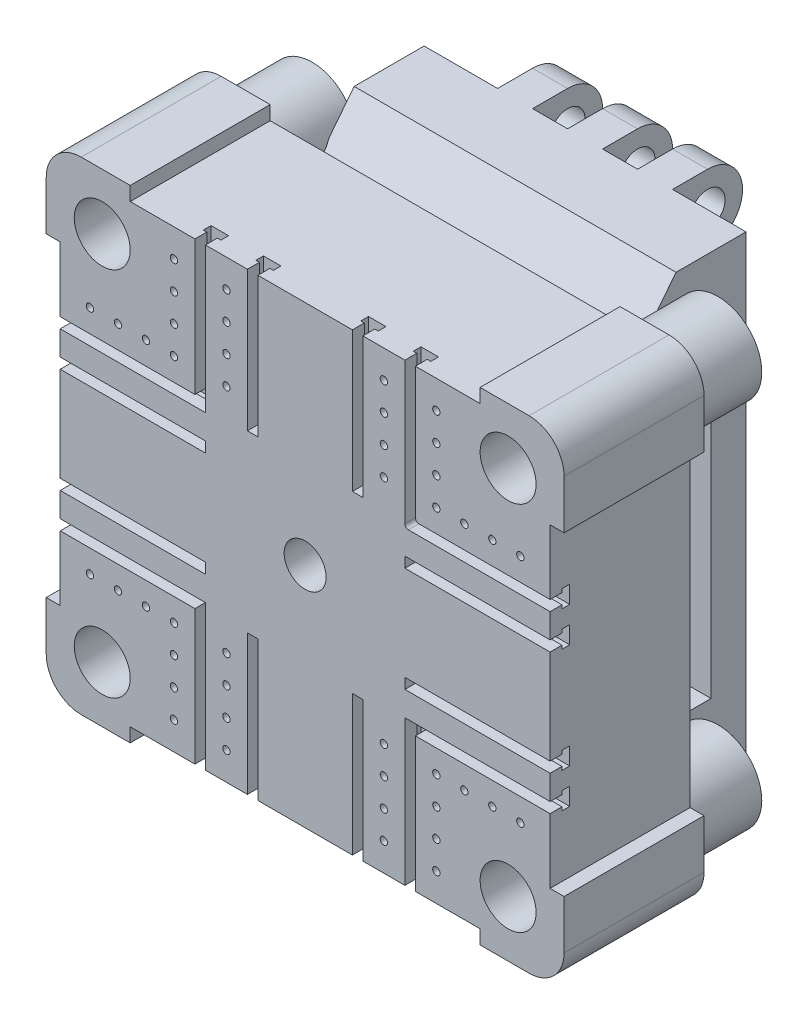
from build123d import *

# Parameters (mm, degrees)
SKETCH1_W                        = 1400
SKETCH1_H                        = 1300
BOSS_EXTRUDE1_DEPTH              = 400
SKETCH2_R                        = 80
BOSS_EXTRUDE2_DEPTH              = 4000
BOSS_EXTRUDE3_DEPTH              = 400
FILLET1_R                        = 100
FILLET1_OF_MIRROR1_R             = 100
MIRROR2_DEPTH                    = 400
SKETCH5_R                        = 60
CUT_EXTRUDE1_DEPTH               = 492
CUT_EXTRUDE2_DEPTH               = 400
MIRROR4_COPY_1_DEPTH             = 400
CUT_EXTRUDE3_REACH               = 4682.78
FILLET3_R                        = 10
CUT_EXTRUDE4_DEPTH               = 415
CUT_EXTRUDE5_DEPTH               = 415
CIRPATTERN1_COUNT                = 2
CIRPATTERN1_COPY_1_DEPTH         = 415
M24X3_0_TAPPED_HOLE1_AT_2_COUNT  = 2
M24X3_0_TAPPED_HOLE1_AT_2_PITCH  = 80
M24X3_0_TAPPED_HOLE1_AT_3_COUNT  = 2
M24X3_0_TAPPED_HOLE1_AT_3_PITCH  = 160
M24X3_0_TAPPED_HOLE1_AT_4_COUNT  = 2
M24X3_0_TAPPED_HOLE1_AT_4_PITCH  = 240
M24X3_0_TAPPED_HOLE1_AT_5_COUNT  = 2
M24X3_0_TAPPED_HOLE1_AT_5_PITCH  = 283.019433962
M24X3_0_TAPPED_HOLE1_AT_6_COUNT  = 2
M24X3_0_TAPPED_HOLE1_AT_6_PITCH  = 219.317121995
M24X3_0_TAPPED_HOLE1_AT_7_COUNT  = 2
M24X3_0_TAPPED_HOLE1_AT_7_PITCH  = 170
M24X3_0_TAPPED_HOLE1_AT_8_COUNT  = 2
M24X3_0_TAPPED_HOLE1_AT_8_PITCH  = 150
M24X3_0_TAPPED_HOLE1_AT_9_COUNT  = 2
M24X3_0_TAPPED_HOLE1_AT_9_PITCH  = 230
M24X3_0_TAPPED_HOLE1_AT_10_COUNT = 2
M24X3_0_TAPPED_HOLE1_AT_10_PITCH = 310
M24X3_0_TAPPED_HOLE1_AT_11_COUNT = 2
M24X3_0_TAPPED_HOLE1_AT_11_PITCH = 390
SKETCH15_R                       = 80
CUT_EXTRUDE6_DEPTH               = 5025
SKETCH16_R                       = 80
BOSS_EXTRUDE4_DEPTH              = 4000
CUT_EXTRUDE7_START               = -5500
SKETCH18_R                       = 80
CUT_EXTRUDE7_DEPTH               = 5500
BOSS_EXTRUDE5_START              = -600
SKETCH19_R                       = 125
SKETCH19_R_2                     = 80
BOSS_EXTRUDE5_DEPTH              = 600
BOSS_EXTRUDE6_DEPTH              = 460
BOSS_EXTRUDE6_DEPTH_BACK         = 460
SKETCH22_W                       = 300
SKETCH22_H                       = 900
CUT_EXTRUDE8_DEPTH               = 920
BOSS_EXTRUDE7_DEPTH              = 920
SKETCH26_W                       = 288.26551034
SKETCH26_H                       = 229.456304203
CUT_EXTRUDE12_DEPTH              = 100
CUT_EXTRUDE13_START              = -100
CUT_EXTRUDE13_DEPTH              = 470
SKETCH28_R                       = 50
CUT_EXTRUDE14_DEPTH              = 637
MIRROR27_COPY_1_SKETCH_W         = 288.26551034
MIRROR27_COPY_1_SKETCH_H         = 229.456304203
MIRROR27_COPY_1_DEPTH            = 100
MIRROR27_START                   = -100
MIRROR27_COPY_2_DEPTH            = 470


# Read off the part's stored shape, not the designer's step: Mirror2
with BuildPart() as part:
    # Sketch1 → Boss-Extrude1 (new body)
    with BuildSketch(Plane.XY):
        Rectangle(SKETCH1_W, SKETCH1_H)
    extrude(amount=BOSS_EXTRUDE1_DEPTH)

    # Sketch2 → Boss-Extrude2 (add)
    with BuildSketch(Plane.XY.offset(400)):
        with Locations(Location((-550, 450, 0), (0, 0, 180))):
            Circle(SKETCH2_R)
        with Locations(Location((550, 450, 0), (0, 0, 180))):
            Circle(SKETCH2_R)
        with Locations(Location((550, -450, 0), (0, 0, 180))):
            Circle(SKETCH2_R)
        with Locations(Location((-550, -450, 0), (0, 0, 180))):
            Circle(SKETCH2_R)
    extrude(amount=BOSS_EXTRUDE2_DEPTH)

    # Sketch3 → Boss-Extrude3 (add)
    with BuildSketch(Plane(origin=(0, 0, 0), x_dir=(-1, 0, 0), z_dir=(0, 0, -1))):
        Polygon((-700, 650), (-500, 650), (-500, 690), (-740, 690), (-740, 450), (-700, 450), align=None)
    boss_extrude3 = extrude(amount=-BOSS_EXTRUDE3_DEPTH)

    # Fillet1
    fillet1_edges = [part.edges().sort_by_distance(p)[0] for p in [
        (740, 690, 200),
    ]]
    fillet(fillet1_edges, radius=FILLET1_R)

    # Mirror1: Boss-Extrude3 across plane
    add(boss_extrude3.mirror(Plane(origin=(0, 0, 0), x_dir=(0, 0, 1), z_dir=(1, 0, 0))))

    # Fillet1 of Mirror1
    fillet1_of_mirror1_edges = [part.edges().sort_by_distance(p)[0] for p in [
        (-740, 690, 200),
    ]]
    fillet(fillet1_of_mirror1_edges, radius=FILLET1_OF_MIRROR1_R)

    # Mirror2 outline → Mirror2 (add)
    with BuildSketch(Plane.XY):
        with BuildLine():
            Line((-500, -690), (-500, -650))
            Line((-500, -650), (-700, -650))
            Line((-700, -650), (-700, -450))
            Line((-700, -450), (-740, -450))
            Line((-740, -450), (-740, -590))
            ThreePointArc((-740, -590), (-710.710678119, -660.710678119), (-640, -690))
            Line((-640, -690), (-500, -690))
        make_face()
        with BuildLine():
            Line((740, -590), (740, -450))
            Line((740, -450), (700, -450))
            Line((700, -450), (700, -650))
            Line((700, -650), (500, -650))
            Line((500, -650), (500, -690))
            Line((500, -690), (640, -690))
            ThreePointArc((640, -690), (710.710678119, -660.710678119), (740, -590))
        make_face()
    extrude(amount=MIRROR2_DEPTH)

    # Sketch5 → Cut-Extrude1 (cut)
    with BuildSketch(Plane.XY.offset(400)):
        Circle(SKETCH5_R)
    extrude(amount=-CUT_EXTRUDE1_DEPTH, mode=Mode.SUBTRACT)

    # Sketch7 → Cut-Extrude2 (cut)
    with BuildSketch(Plane.XZ.offset(650)):
        Polygon((275, 344), (325, 344), (325, 366), (315, 366), (315, 400), (285, 400), (285, 366), (275, 366), align=None)
        Polygon((125, 344), (175, 344), (175, 366), (165, 366), (165, 400), (135, 400), (135, 366), (125, 366), align=None)
    cut_extrude2 = extrude(amount=-CUT_EXTRUDE2_DEPTH, mode=Mode.SUBTRACT)

    # Mirror3: Cut-Extrude2 across plane
    add(cut_extrude2.mirror(Plane(origin=(0, 0, 0), x_dir=(0, 0, 1), z_dir=(1, 0, 0))), mode=Mode.SUBTRACT)

    # Mirror4: Cut-Extrude2 across plane
    add(cut_extrude2.mirror(Plane.ZX), mode=Mode.SUBTRACT)

    # Mirror4 copy 1 sketch → Mirror4 copy 1 (cut)
    with BuildSketch(Plane(origin=(0, 650, 0), x_dir=(-1, 0, 0), z_dir=(0, 1, 0))):
        Polygon((275, 344), (325, 344), (325, 366), (315, 366), (315, 400), (285, 400), (285, 366), (275, 366), align=None)
        Polygon((125, 344), (175, 344), (175, 366), (165, 366), (165, 400), (135, 400), (135, 366), (125, 366), align=None)
    extrude(amount=-MIRROR4_COPY_1_DEPTH, mode=Mode.SUBTRACT)

    # Cut-Extrude3: up to this face of the body (flat: up to its plane)
    cut_extrude3_end = Plane(part.part.faces().sort_by_distance((285, 450, 383))[0])
    # Sketch8 → Cut-Extrude3 (cut, up to the picked face)
    with BuildSketch(Plane(origin=(700, 0, 0), x_dir=(0, 0, -1), z_dir=(1, 0, 0)), mode=Mode.PRIVATE) as cut_extrude3_sk1:
        Polygon((-344, 275), (-344, 225), (-366, 225), (-366, 235), (-400, 235), (-400, 265), (-366, 265), (-366, 275), align=None)
    cut_extrude3_tool1 = split(extrude(cut_extrude3_sk1.sketch, amount=-CUT_EXTRUDE3_REACH, mode=Mode.PRIVATE), bisect_by=cut_extrude3_end, keep=Keep.BOTH, mode=Mode.PRIVATE)
    cut_extrude3 = cut_extrude3_tool1.solids().sort_by(Axis((700, 250, 368.471698), (-1, 0, 0)))[0]
    add(cut_extrude3, mode=Mode.SUBTRACT)

    # Fillet3
    fillet3_edges = [part.edges().sort_by_distance(p)[0] for p in [
        (315, 265, 383),
        (285, 235, 383),
    ]]
    fillet(fillet3_edges, radius=FILLET3_R)

    # Mirror5: Cut-Extrude3 across plane
    add(cut_extrude3.mirror(Plane.ZX), mode=Mode.SUBTRACT)

    # Sketch9 → Cut-Extrude4 (cut)
    with BuildSketch(Plane.ZY.offset(700)):
        Polygon((400, 265), (366, 265), (366, 275), (344, 275), (344, 225), (366, 225), (366, 235), (400, 235), align=None)
    cut_extrude4 = extrude(amount=-CUT_EXTRUDE4_DEPTH, mode=Mode.SUBTRACT)

    # Mirror12: Cut-Extrude4 across plane
    add(cut_extrude4.mirror(Plane.ZX), mode=Mode.SUBTRACT)

    # Sketch10 → Cut-Extrude5 (cut)
    with BuildSketch(Plane(origin=(700, 0, 0), x_dir=(0, 0, -1), z_dir=(1, 0, 0))):
        Polygon((-344, 175), (-344, 125), (-366, 125), (-366, 135), (-400, 135), (-400, 165), (-366, 165), (-366, 175), align=None)
    cut_extrude5 = extrude(amount=-CUT_EXTRUDE5_DEPTH, mode=Mode.SUBTRACT)

    # Mirror13: Cut-Extrude5 across plane
    add(cut_extrude5.mirror(Plane.ZX), mode=Mode.SUBTRACT)

    # CirPattern1: Cut-Extrude5 ×2 about axis
    cirpattern1_axis = Axis((0, 0, 0), (0, 0, 1))
    for i in range(1, CIRPATTERN1_COUNT):
        add(cut_extrude5.rotate(cirpattern1_axis, i * 360 / CIRPATTERN1_COUNT), mode=Mode.SUBTRACT)

    # CirPattern1 copy 1 sketch → CirPattern1 copy 1 (cut)
    with BuildSketch(Plane(origin=(-700, 0, 0), x_dir=(0, 0, -1), z_dir=(-1, 0, 0))):
        Polygon((-344, -175), (-344, -125), (-366, -125), (-366, -135), (-400, -135), (-400, -165), (-366, -165), (-366, -175), align=None)
    extrude(amount=-CIRPATTERN1_COPY_1_DEPTH, mode=Mode.SUBTRACT)

    # Sketch14 → M24x3.0 Tapped Hole1 (revolve, cut)
    with BuildSketch(Plane(origin=(225, -330, 400), x_dir=(0, -1, 0), z_dir=(1, 0, 0))):
        Polygon((0, 0), (0, 66.3090365), (10.5, 60), (10.5, 0), align=None)
    m24x3_0_tapped_hole1 = revolve(axis=Axis((225, -330, 406.35), (0, 0, -1)), mode=Mode.SUBTRACT)

    # M24x3.0 Tapped Hole1 at 2: M24x3.0 Tapped Hole1 ×2
    with Locations(*[(0, -i * M24X3_0_TAPPED_HOLE1_AT_2_PITCH, 0) for i in range(1, M24X3_0_TAPPED_HOLE1_AT_2_COUNT)]):
        add(m24x3_0_tapped_hole1, mode=Mode.SUBTRACT)

    # M24x3.0 Tapped Hole1 at 3: M24x3.0 Tapped Hole1 ×2
    with Locations(*[(0, -i * M24X3_0_TAPPED_HOLE1_AT_3_PITCH, 0) for i in range(1, M24X3_0_TAPPED_HOLE1_AT_3_COUNT)]):
        add(m24x3_0_tapped_hole1, mode=Mode.SUBTRACT)

    # M24x3.0 Tapped Hole1 at 4: M24x3.0 Tapped Hole1 ×2
    with Locations(*[(0, -i * M24X3_0_TAPPED_HOLE1_AT_4_PITCH, 0) for i in range(1, M24X3_0_TAPPED_HOLE1_AT_4_COUNT)]):
        add(m24x3_0_tapped_hole1, mode=Mode.SUBTRACT)

    # M24x3.0 Tapped Hole1 at 5: M24x3.0 Tapped Hole1 ×2
    with Locations(*[Vector(0.5299989400031799, -0.8479983040050881, 0) * (i * M24X3_0_TAPPED_HOLE1_AT_5_PITCH) for i in range(1, M24X3_0_TAPPED_HOLE1_AT_5_COUNT)]):
        add(m24x3_0_tapped_hole1, mode=Mode.SUBTRACT)

    # M24x3.0 Tapped Hole1 at 6: M24x3.0 Tapped Hole1 ×2
    with Locations(*[Vector(0.6839411288813297, -0.7295372041400852, 0) * (i * M24X3_0_TAPPED_HOLE1_AT_6_PITCH) for i in range(1, M24X3_0_TAPPED_HOLE1_AT_6_COUNT)]):
        add(m24x3_0_tapped_hole1, mode=Mode.SUBTRACT)

    # M24x3.0 Tapped Hole1 at 7: M24x3.0 Tapped Hole1 ×2
    with Locations(*[Vector(0.8823529411764706, -0.47058823529411786, 0) * (i * M24X3_0_TAPPED_HOLE1_AT_7_PITCH) for i in range(1, M24X3_0_TAPPED_HOLE1_AT_7_COUNT)]):
        add(m24x3_0_tapped_hole1, mode=Mode.SUBTRACT)

    # M24x3.0 Tapped Hole1 at 8: M24x3.0 Tapped Hole1 ×2
    with Locations(*[(i * M24X3_0_TAPPED_HOLE1_AT_8_PITCH, 0, 0) for i in range(1, M24X3_0_TAPPED_HOLE1_AT_8_COUNT)]):
        add(m24x3_0_tapped_hole1, mode=Mode.SUBTRACT)

    # M24x3.0 Tapped Hole1 at 9: M24x3.0 Tapped Hole1 ×2
    with Locations(*[(i * M24X3_0_TAPPED_HOLE1_AT_9_PITCH, 0, 0) for i in range(1, M24X3_0_TAPPED_HOLE1_AT_9_COUNT)]):
        add(m24x3_0_tapped_hole1, mode=Mode.SUBTRACT)

    # M24x3.0 Tapped Hole1 at 10: M24x3.0 Tapped Hole1 ×2
    with Locations(*[(i * M24X3_0_TAPPED_HOLE1_AT_10_PITCH, 0, 0) for i in range(1, M24X3_0_TAPPED_HOLE1_AT_10_COUNT)]):
        add(m24x3_0_tapped_hole1, mode=Mode.SUBTRACT)

    # M24x3.0 Tapped Hole1 at 11: M24x3.0 Tapped Hole1 ×2
    with Locations(*[(i * M24X3_0_TAPPED_HOLE1_AT_11_PITCH, 0, 0) for i in range(1, M24X3_0_TAPPED_HOLE1_AT_11_COUNT)]):
        add(m24x3_0_tapped_hole1, mode=Mode.SUBTRACT)

    # Mirror22: M24x3.0 Tapped Hole1 across plane
    add(m24x3_0_tapped_hole1.mirror(Plane.ZX), mode=Mode.SUBTRACT)

    # Mirror22 copy 1 sketch → Mirror22 copy 1 (revolve, cut)
    with BuildSketch(Plane(origin=(225, 410, 400), x_dir=(0, 1, 0), z_dir=(1, 0, 0))):
        Polygon((0, 0), (0, -66.3090365), (10.5, -60), (10.5, 0), align=None)
    revolve(axis=Axis((225, 410, 406.35), (0, 0, 1)), mode=Mode.SUBTRACT)

    # Mirror22 copy 2 sketch → Mirror22 copy 2 (revolve, cut)
    with BuildSketch(Plane(origin=(225, 490, 400), x_dir=(0, 1, 0), z_dir=(1, 0, 0))):
        Polygon((0, 0), (0, -66.3090365), (10.5, -60), (10.5, 0), align=None)
    revolve(axis=Axis((225, 490, 406.35), (0, 0, 1)), mode=Mode.SUBTRACT)

    # Mirror22 copy 3 sketch → Mirror22 copy 3 (revolve, cut)
    with BuildSketch(Plane(origin=(225, 570, 400), x_dir=(0, 1, 0), z_dir=(1, 0, 0))):
        Polygon((0, 0), (0, -66.3090365), (10.5, -60), (10.5, 0), align=None)
    revolve(axis=Axis((225, 570, 406.35), (0, 0, 1)), mode=Mode.SUBTRACT)

    # Mirror22 copy 4 sketch → Mirror22 copy 4 (revolve, cut)
    with BuildSketch(Plane(origin=(375, 570, 400), x_dir=(0, 1, 0), z_dir=(1, 0, 0))):
        Polygon((0, 0), (0, -66.3090365), (10.5, -60), (10.5, 0), align=None)
    revolve(axis=Axis((375, 570, 406.35), (0, 0, 1)), mode=Mode.SUBTRACT)

    # Mirror22 copy 5 sketch → Mirror22 copy 5 (revolve, cut)
    with BuildSketch(Plane(origin=(375, 490, 400), x_dir=(0, 1, 0), z_dir=(1, 0, 0))):
        Polygon((0, 0), (0, -66.3090365), (10.5, -60), (10.5, 0), align=None)
    revolve(axis=Axis((375, 490, 406.35), (0, 0, 1)), mode=Mode.SUBTRACT)

    # Mirror22 copy 6 sketch → Mirror22 copy 6 (revolve, cut)
    with BuildSketch(Plane(origin=(375, 410, 400), x_dir=(0, 1, 0), z_dir=(1, 0, 0))):
        Polygon((0, 0), (0, -66.3090365), (10.5, -60), (10.5, 0), align=None)
    revolve(axis=Axis((375, 410, 406.35), (0, 0, 1)), mode=Mode.SUBTRACT)

    # Mirror22 copy 7 sketch → Mirror22 copy 7 (revolve, cut)
    with BuildSketch(Plane(origin=(375, 330, 400), x_dir=(0, 1, 0), z_dir=(1, 0, 0))):
        Polygon((0, 0), (0, -66.3090365), (10.5, -60), (10.5, 0), align=None)
    revolve(axis=Axis((375, 330, 406.35), (0, 0, 1)), mode=Mode.SUBTRACT)

    # Mirror22 copy 8 sketch → Mirror22 copy 8 (revolve, cut)
    with BuildSketch(Plane(origin=(455, 330, 400), x_dir=(0, 1, 0), z_dir=(1, 0, 0))):
        Polygon((0, 0), (0, -66.3090365), (10.5, -60), (10.5, 0), align=None)
    revolve(axis=Axis((455, 330, 406.35), (0, 0, 1)), mode=Mode.SUBTRACT)

    # Mirror22 copy 9 sketch → Mirror22 copy 9 (revolve, cut)
    with BuildSketch(Plane(origin=(535, 330, 400), x_dir=(0, 1, 0), z_dir=(1, 0, 0))):
        Polygon((0, 0), (0, -66.3090365), (10.5, -60), (10.5, 0), align=None)
    revolve(axis=Axis((535, 330, 406.35), (0, 0, 1)), mode=Mode.SUBTRACT)

    # Mirror22 copy 10 sketch → Mirror22 copy 10 (revolve, cut)
    with BuildSketch(Plane(origin=(615, 330, 400), x_dir=(0, 1, 0), z_dir=(1, 0, 0))):
        Polygon((0, 0), (0, -66.3090365), (10.5, -60), (10.5, 0), align=None)
    revolve(axis=Axis((615, 330, 406.35), (0, 0, 1)), mode=Mode.SUBTRACT)

    # Mirror23: M24x3.0 Tapped Hole1 across plane
    add(m24x3_0_tapped_hole1.mirror(Plane(origin=(0, 0, 0), x_dir=(0, 0, 1), z_dir=(1, 0, 0))), mode=Mode.SUBTRACT)

    # Mirror23 copy 1 sketch → Mirror23 copy 1 (revolve, cut)
    with BuildSketch(Plane(origin=(-225, -410, 400), x_dir=(0, -1, 0), z_dir=(-1, 0, 0))):
        Polygon((0, 0), (0, -66.3090365), (10.5, -60), (10.5, 0), align=None)
    revolve(axis=Axis((-225, -410, 406.35), (0, 0, 1)), mode=Mode.SUBTRACT)

    # Mirror23 copy 2 sketch → Mirror23 copy 2 (revolve, cut)
    with BuildSketch(Plane(origin=(-225, -490, 400), x_dir=(0, -1, 0), z_dir=(-1, 0, 0))):
        Polygon((0, 0), (0, -66.3090365), (10.5, -60), (10.5, 0), align=None)
    revolve(axis=Axis((-225, -490, 406.35), (0, 0, 1)), mode=Mode.SUBTRACT)

    # Mirror23 copy 3 sketch → Mirror23 copy 3 (revolve, cut)
    with BuildSketch(Plane(origin=(-225, -570, 400), x_dir=(0, -1, 0), z_dir=(-1, 0, 0))):
        Polygon((0, 0), (0, -66.3090365), (10.5, -60), (10.5, 0), align=None)
    revolve(axis=Axis((-225, -570, 406.35), (0, 0, 1)), mode=Mode.SUBTRACT)

    # Mirror23 copy 4 sketch → Mirror23 copy 4 (revolve, cut)
    with BuildSketch(Plane(origin=(-375, -570, 400), x_dir=(0, -1, 0), z_dir=(-1, 0, 0))):
        Polygon((0, 0), (0, -66.3090365), (10.5, -60), (10.5, 0), align=None)
    revolve(axis=Axis((-375, -570, 406.35), (0, 0, 1)), mode=Mode.SUBTRACT)

    # Mirror23 copy 5 sketch → Mirror23 copy 5 (revolve, cut)
    with BuildSketch(Plane(origin=(-375, -490, 400), x_dir=(0, -1, 0), z_dir=(-1, 0, 0))):
        Polygon((0, 0), (0, -66.3090365), (10.5, -60), (10.5, 0), align=None)
    revolve(axis=Axis((-375, -490, 406.35), (0, 0, 1)), mode=Mode.SUBTRACT)

    # Mirror23 copy 6 sketch → Mirror23 copy 6 (revolve, cut)
    with BuildSketch(Plane(origin=(-375, -410, 400), x_dir=(0, -1, 0), z_dir=(-1, 0, 0))):
        Polygon((0, 0), (0, -66.3090365), (10.5, -60), (10.5, 0), align=None)
    revolve(axis=Axis((-375, -410, 406.35), (0, 0, 1)), mode=Mode.SUBTRACT)

    # Mirror23 copy 7 sketch → Mirror23 copy 7 (revolve, cut)
    with BuildSketch(Plane(origin=(-375, -330, 400), x_dir=(0, -1, 0), z_dir=(-1, 0, 0))):
        Polygon((0, 0), (0, -66.3090365), (10.5, -60), (10.5, 0), align=None)
    revolve(axis=Axis((-375, -330, 406.35), (0, 0, 1)), mode=Mode.SUBTRACT)

    # Mirror23 copy 8 sketch → Mirror23 copy 8 (revolve, cut)
    with BuildSketch(Plane(origin=(-455, -330, 400), x_dir=(0, -1, 0), z_dir=(-1, 0, 0))):
        Polygon((0, 0), (0, -66.3090365), (10.5, -60), (10.5, 0), align=None)
    revolve(axis=Axis((-455, -330, 406.35), (0, 0, 1)), mode=Mode.SUBTRACT)

    # Mirror23 copy 9 sketch → Mirror23 copy 9 (revolve, cut)
    with BuildSketch(Plane(origin=(-535, -330, 400), x_dir=(0, -1, 0), z_dir=(-1, 0, 0))):
        Polygon((0, 0), (0, -66.3090365), (10.5, -60), (10.5, 0), align=None)
    revolve(axis=Axis((-535, -330, 406.35), (0, 0, 1)), mode=Mode.SUBTRACT)

    # Mirror23 copy 10 sketch → Mirror23 copy 10 (revolve, cut)
    with BuildSketch(Plane(origin=(-615, -330, 400), x_dir=(0, -1, 0), z_dir=(-1, 0, 0))):
        Polygon((0, 0), (0, -66.3090365), (10.5, -60), (10.5, 0), align=None)
    revolve(axis=Axis((-615, -330, 406.35), (0, 0, 1)), mode=Mode.SUBTRACT)

    # Mirror23 copy 11 sketch → Mirror23 copy 11 (revolve, cut)
    with BuildSketch(Plane(origin=(-225, 330, 400), x_dir=(0, 1, 0), z_dir=(-1, 0, 0))):
        Polygon((0, 0), (0, 66.3090365), (10.5, 60), (10.5, 0), align=None)
    revolve(axis=Axis((-225, 330, 406.35), (0, 0, -1)), mode=Mode.SUBTRACT)

    # Mirror23 copy 12 sketch → Mirror23 copy 12 (revolve, cut)
    with BuildSketch(Plane(origin=(-225, 410, 400), x_dir=(0, 1, 0), z_dir=(-1, 0, 0))):
        Polygon((0, 0), (0, 66.3090365), (10.5, 60), (10.5, 0), align=None)
    revolve(axis=Axis((-225, 410, 406.35), (0, 0, -1)), mode=Mode.SUBTRACT)

    # Mirror23 copy 13 sketch → Mirror23 copy 13 (revolve, cut)
    with BuildSketch(Plane(origin=(-225, 490, 400), x_dir=(0, 1, 0), z_dir=(-1, 0, 0))):
        Polygon((0, 0), (0, 66.3090365), (10.5, 60), (10.5, 0), align=None)
    revolve(axis=Axis((-225, 490, 406.35), (0, 0, -1)), mode=Mode.SUBTRACT)

    # Mirror23 copy 14 sketch → Mirror23 copy 14 (revolve, cut)
    with BuildSketch(Plane(origin=(-225, 570, 400), x_dir=(0, 1, 0), z_dir=(-1, 0, 0))):
        Polygon((0, 0), (0, 66.3090365), (10.5, 60), (10.5, 0), align=None)
    revolve(axis=Axis((-225, 570, 406.35), (0, 0, -1)), mode=Mode.SUBTRACT)

    # Mirror23 copy 15 sketch → Mirror23 copy 15 (revolve, cut)
    with BuildSketch(Plane(origin=(-375, 570, 400), x_dir=(0, 1, 0), z_dir=(-1, 0, 0))):
        Polygon((0, 0), (0, 66.3090365), (10.5, 60), (10.5, 0), align=None)
    revolve(axis=Axis((-375, 570, 406.35), (0, 0, -1)), mode=Mode.SUBTRACT)

    # Mirror23 copy 16 sketch → Mirror23 copy 16 (revolve, cut)
    with BuildSketch(Plane(origin=(-375, 490, 400), x_dir=(0, 1, 0), z_dir=(-1, 0, 0))):
        Polygon((0, 0), (0, 66.3090365), (10.5, 60), (10.5, 0), align=None)
    revolve(axis=Axis((-375, 490, 406.35), (0, 0, -1)), mode=Mode.SUBTRACT)

    # Mirror23 copy 17 sketch → Mirror23 copy 17 (revolve, cut)
    with BuildSketch(Plane(origin=(-375, 410, 400), x_dir=(0, 1, 0), z_dir=(-1, 0, 0))):
        Polygon((0, 0), (0, 66.3090365), (10.5, 60), (10.5, 0), align=None)
    revolve(axis=Axis((-375, 410, 406.35), (0, 0, -1)), mode=Mode.SUBTRACT)

    # Mirror23 copy 18 sketch → Mirror23 copy 18 (revolve, cut)
    with BuildSketch(Plane(origin=(-375, 330, 400), x_dir=(0, 1, 0), z_dir=(-1, 0, 0))):
        Polygon((0, 0), (0, 66.3090365), (10.5, 60), (10.5, 0), align=None)
    revolve(axis=Axis((-375, 330, 406.35), (0, 0, -1)), mode=Mode.SUBTRACT)

    # Mirror23 copy 19 sketch → Mirror23 copy 19 (revolve, cut)
    with BuildSketch(Plane(origin=(-455, 330, 400), x_dir=(0, 1, 0), z_dir=(-1, 0, 0))):
        Polygon((0, 0), (0, 66.3090365), (10.5, 60), (10.5, 0), align=None)
    revolve(axis=Axis((-455, 330, 406.35), (0, 0, -1)), mode=Mode.SUBTRACT)

    # Mirror23 copy 20 sketch → Mirror23 copy 20 (revolve, cut)
    with BuildSketch(Plane(origin=(-535, 330, 400), x_dir=(0, 1, 0), z_dir=(-1, 0, 0))):
        Polygon((0, 0), (0, 66.3090365), (10.5, 60), (10.5, 0), align=None)
    revolve(axis=Axis((-535, 330, 406.35), (0, 0, -1)), mode=Mode.SUBTRACT)

    # Mirror23 copy 21 sketch → Mirror23 copy 21 (revolve, cut)
    with BuildSketch(Plane(origin=(-615, 330, 400), x_dir=(0, 1, 0), z_dir=(-1, 0, 0))):
        Polygon((0, 0), (0, 66.3090365), (10.5, 60), (10.5, 0), align=None)
    revolve(axis=Axis((-615, 330, 406.35), (0, 0, -1)), mode=Mode.SUBTRACT)

    # Sketch15 → Cut-Extrude6 (cut)
    with BuildSketch(Plane.XY.offset(400)):
        with Locations((-550, 450)):
            Circle(SKETCH15_R)
        with Locations((550, 450)):
            Circle(SKETCH15_R)
        with Locations((550, -450)):
            Circle(SKETCH15_R)
        with Locations((-550, -450)):
            Circle(SKETCH15_R)
    extrude(amount=CUT_EXTRUDE6_DEPTH, mode=Mode.SUBTRACT)

    # Sketch16 → Boss-Extrude4 (add)
    with BuildSketch(Plane.XY.offset(400)):
        with Locations(Location((-580, 530, 0), (0, 0, 180))):
            Circle(SKETCH16_R)
        with Locations(Location((580, 530, 0), (0, 0, 180))):
            Circle(SKETCH16_R)
        with Locations(Location((580, -530, 0), (0, 0, 180))):
            Circle(SKETCH16_R)
        with Locations(Location((-580, -530, 0), (0, 0, 180))):
            Circle(SKETCH16_R)
    extrude(amount=BOSS_EXTRUDE4_DEPTH)

    # Sketch18 → Cut-Extrude7 (cut)
    with BuildSketch(Plane.XY.offset(4400).offset(CUT_EXTRUDE7_START)):
        with Locations(Location((580, 530, 0), (0, 0, 180))):
            Circle(SKETCH18_R)
        with Locations(Location((580, -530, 0), (0, 0, 180))):
            Circle(SKETCH18_R)
        with Locations(Location((-580, 530, 0), (0, 0, 180))):
            Circle(SKETCH18_R)
        with Locations(Location((-580, -530, 0), (0, 0, 180))):
            Circle(SKETCH18_R)
    extrude(amount=CUT_EXTRUDE7_DEPTH, mode=Mode.SUBTRACT)

    # Sketch19 → Boss-Extrude5 (add)
    # profile 1 of 4: a face of its own
    with BuildSketch(Plane.XY.offset(400).offset(BOSS_EXTRUDE5_START)):
        with Locations((-580, 530)):
            Circle(SKETCH19_R)
        with Locations((-580, 530)):
            Circle(SKETCH19_R_2, mode=Mode.SUBTRACT)
    # profile 2 of 4: a face of its own
    with BuildSketch(Plane.XY.offset(400).offset(BOSS_EXTRUDE5_START)):
        with Locations((580, 530)):
            Circle(SKETCH19_R)
        with Locations((580, 530)):
            Circle(SKETCH19_R_2, mode=Mode.SUBTRACT)
    # profile 3 of 4: a face of its own
    with BuildSketch(Plane.XY.offset(400).offset(BOSS_EXTRUDE5_START)):
        with Locations((580, -530)):
            Circle(SKETCH19_R)
        with Locations((580, -530)):
            Circle(SKETCH19_R_2, mode=Mode.SUBTRACT)
    # profile 4 of 4: a face of its own
    with BuildSketch(Plane.XY.offset(400).offset(BOSS_EXTRUDE5_START)):
        with Locations((-580, -530)):
            Circle(SKETCH19_R)
        with Locations((-580, -530)):
            Circle(SKETCH19_R_2, mode=Mode.SUBTRACT)
    extrude(amount=BOSS_EXTRUDE5_DEPTH)

    # Sketch21 → Boss-Extrude6 (add, two sides: drawn at the far end of the back side and taken through both)
    with BuildSketch(Plane(origin=(0, 0, 0), x_dir=(0, 0, -1), z_dir=(1, 0, 0)).offset(-BOSS_EXTRUDE6_DEPTH_BACK)):
        Polygon((0, -400), (0, 400), (200, 655), (400, 655), (400, -655), (200, -655), align=None)
    extrude(amount=BOSS_EXTRUDE6_DEPTH + BOSS_EXTRUDE6_DEPTH_BACK)

    # Sketch22 → Cut-Extrude8 (cut)
    with BuildSketch(Plane(origin=(460, 0, 0), x_dir=(0, 0, -1), z_dir=(1, 0, 0))):
        with Locations((150, 0)):
            Rectangle(SKETCH22_W, SKETCH22_H)
    extrude(amount=-CUT_EXTRUDE8_DEPTH, mode=Mode.SUBTRACT)

    # Sketch23 → Boss-Extrude7 (add)
    with BuildSketch(Plane.ZY.offset(460)):
        with BuildLine():
            Line((-400, 655), (-500, 655))
            ThreePointArc((-500, 655), (-600, 555), (-500, 455))
            Line((-500, 455), (-400, 455))
            Line((-400, 455), (-400, 655))
        make_face()
    boss_extrude7 = extrude(amount=-BOSS_EXTRUDE7_DEPTH)

    # Mirror24: Boss-Extrude7 across plane
    add(boss_extrude7.mirror(Plane.ZX))

    # Sketch26 → Cut-Extrude12 (cut)
    with BuildSketch(Plane(origin=(50, 0, 0), x_dir=(0, 0, -1), z_dir=(1, 0, 0))):
        with Locations((544.13275517, 569.728152101)):
            Rectangle(SKETCH26_W, SKETCH26_H)
    cut_extrude12 = extrude(amount=CUT_EXTRUDE12_DEPTH, mode=Mode.SUBTRACT)

    # Mirror25: Cut-Extrude12 across plane
    add(cut_extrude12.mirror(Plane(origin=(0, 0, 0), x_dir=(0, 0, 1), z_dir=(1, 0, 0))), mode=Mode.SUBTRACT)

    # Sketch27 → Cut-Extrude13 (cut)
    with BuildSketch(Plane.ZY.offset(-150).offset(CUT_EXTRUDE13_START)):
        with BuildLine():
            Line((-500, 455), (-400, 455))
            Line((-400, 455), (-400, 655))
            Line((-400, 655), (-500, 655))
            ThreePointArc((-500, 655), (-600, 555), (-500, 455))
        make_face()
    cut_extrude13 = extrude(amount=-CUT_EXTRUDE13_DEPTH, mode=Mode.SUBTRACT)

    # Mirror26: Cut-Extrude13 across plane
    add(cut_extrude13.mirror(Plane(origin=(0, 0, 0), x_dir=(0, 0, 1), z_dir=(1, 0, 0))), mode=Mode.SUBTRACT)

    # Sketch28 → Cut-Extrude14 (cut)
    with BuildSketch(Plane(origin=(250, 0, 0), x_dir=(0, 0, -1), z_dir=(1, 0, 0))):
        with Locations((500, 555)):
            Circle(SKETCH28_R)
    cut_extrude14 = extrude(amount=-CUT_EXTRUDE14_DEPTH, mode=Mode.SUBTRACT)

    # Mirror27: Cut-Extrude12, Cut-Extrude13, Cut-Extrude14 across plane
    add(cut_extrude12.mirror(Plane.ZX), mode=Mode.SUBTRACT)
    add(cut_extrude13.mirror(Plane.ZX), mode=Mode.SUBTRACT)
    add(cut_extrude14.mirror(Plane.ZX), mode=Mode.SUBTRACT)

    # Mirror27 copy 1 sketch → Mirror27 copy 1 (cut)
    with BuildSketch(Plane(origin=(-50, 0, 0), x_dir=(0, 0, -1), z_dir=(-1, 0, 0))):
        with Locations((544.13275517, 569.728152101)):
            Rectangle(MIRROR27_COPY_1_SKETCH_W, MIRROR27_COPY_1_SKETCH_H)
    extrude(amount=MIRROR27_COPY_1_DEPTH, mode=Mode.SUBTRACT)

    # Mirror27 copy 2 sketch → Mirror27 copy 2 (cut)
    with BuildSketch(Plane(origin=(-150, 0, 0), x_dir=(0, 0, 1), z_dir=(1, 0, 0)).offset(MIRROR27_START)):
        with BuildLine():
            Line((-500, 455), (-400, 455))
            Line((-400, 455), (-400, 655))
            Line((-400, 655), (-500, 655))
            ThreePointArc((-500, 655), (-600, 555), (-500, 455))
        make_face()
    extrude(amount=-MIRROR27_COPY_2_DEPTH, mode=Mode.SUBTRACT)


solid = part.part
